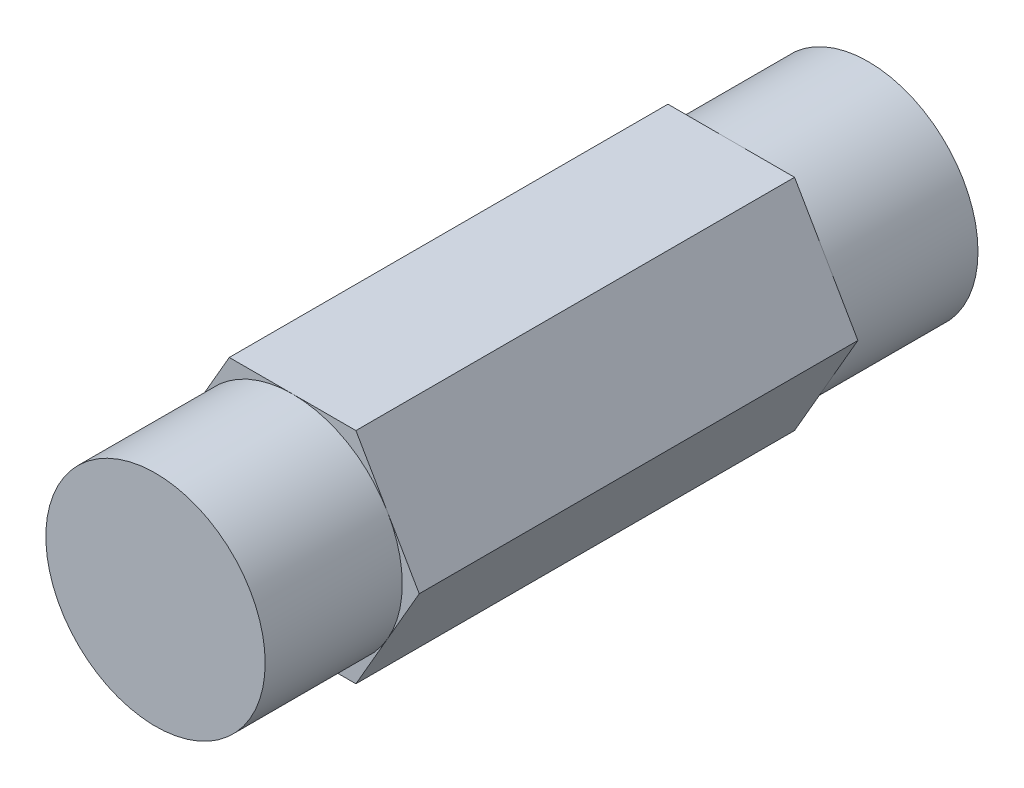
from build123d import *

# Parameters (mm, degrees)
BOSS_EXTRUDE1_DEPTH = 20.6375
SKETCH2_OUTSIDE_W   = 25.786
SKETCH2_OUTSIDE_H   = 23.822
SKETCH2_OUTSIDE_R   = 6.35
CUT_EXTRUDE4_DEPTH  = 7.9375


with BuildPart() as part:
    # Sketch1 → Boss-Extrude1 (new, symmetric)
    with BuildSketch(Plane.XY):
        Polygon((3.666174209, 6.35), (-3.666174209, 6.35), (-7.332348419, 0), (-3.666174209, -6.35), (3.666174209, -6.35), (7.332348419, 0), align=None)
    extrude(amount=BOSS_EXTRUDE1_DEPTH, both=True)

    # Sketch2 outside → Cut-Extrude4 (cut)
    with BuildSketch(Plane.XY.offset(20.6375)):
        Rectangle(SKETCH2_OUTSIDE_W, SKETCH2_OUTSIDE_H)
        Circle(SKETCH2_OUTSIDE_R, mode=Mode.SUBTRACT)
    cut_extrude4 = extrude(amount=-CUT_EXTRUDE4_DEPTH, mode=Mode.SUBTRACT)

    # Mirror1: Cut-Extrude4 across plane
    add(cut_extrude4.mirror(Plane.XY), mode=Mode.SUBTRACT)


solid = part.part
